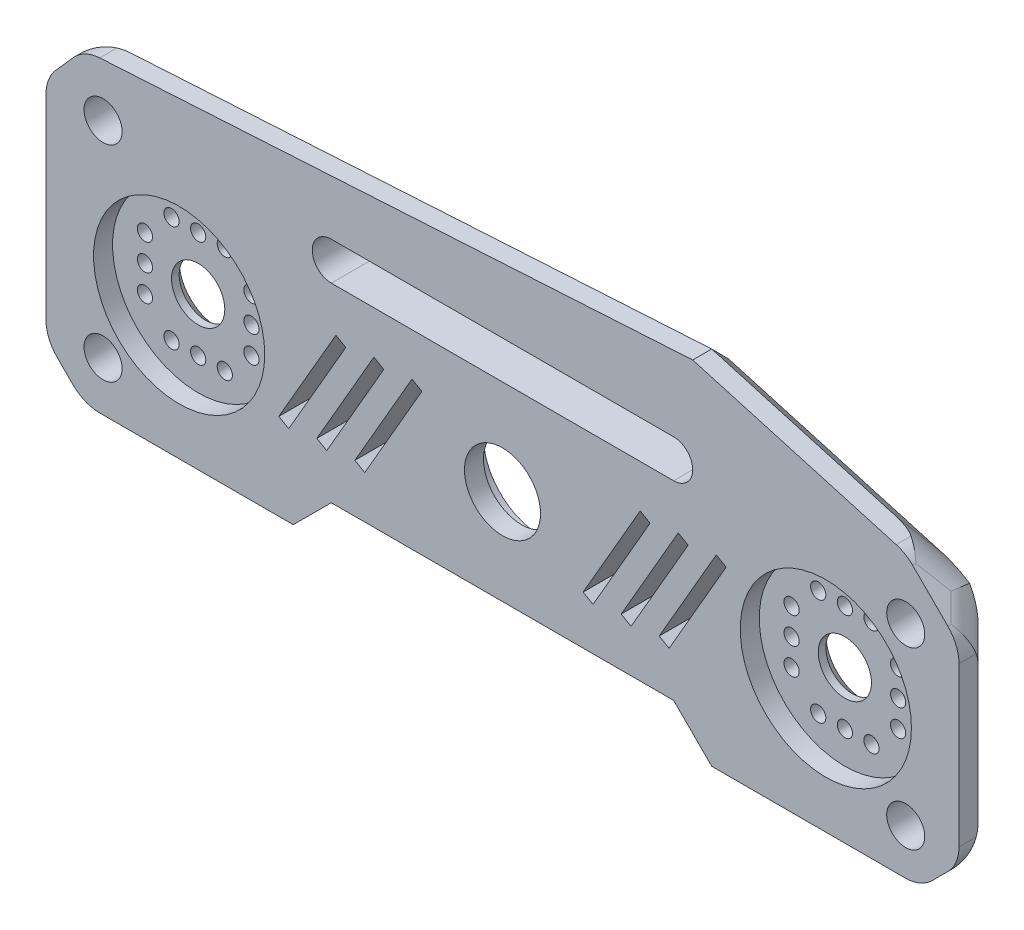
from build123d import *

# Parameters (mm, degrees)
SKETCH1_W           = 17.5
SKETCH1_H           = 25
SKETCH1_W_2         = 50
BOSS_EXTRUDE1_DEPTH = 5
SKETCH2_R           = 11.25
CUT_EXTRUDE1_DEPTH  = 2.5
SKETCH3_R           = 1
SKETCH3_R_2         = 3.5
CUT_EXTRUDE2_DEPTH  = 5
SKETCH4_R           = 5
CUT_EXTRUDE3_DEPTH  = 5
CUT_EXTRUDE4_DEPTH  = 5
CHAMFER3_SIZE       = 1.5
BOSS_EXTRUDE2_DEPTH = 5
CHAMFER4_SIZE       = 2.5
CUT_EXTRUDE11_DEPTH = 5
SKETCH10_R          = 2.5
CUT_EXTRUDE13_DEPTH = 5
CHAMFER5_SIZE       = 5
CHAMFER5_SIZE_2     = 7.280109889
CHAMFER5_SIZE_3     = 5.321683239
FILLET1_R           = 5
SKETCH12_R          = 7.5
CUT_EXTRUDE14_DEPTH = 2.5


# Some blends are built 0.0001 mm under size
with BuildPart() as part:
    # Sketch1 → Boss-Extrude1 (new body)
    with BuildSketch(Plane.XY):
        with Locations((-33.75, 0)):
            Rectangle(SKETCH1_W, SKETCH1_H)
        Polygon((-25, -12.5), (-42.5, -12.5), (-42.5, 12.5), (-25, 12.5), (-25, 17.5), (-60, 17.5), (-60, -17.5), (-25, -17.5), align=None)
        Rectangle(SKETCH1_W_2, SKETCH1_H)
        with Locations((33.75, 0)):
            Rectangle(SKETCH1_W, SKETCH1_H)
        Polygon((42.5, -12.5), (25, -12.5), (25, -17.5), (60, -17.5), (60, 17.5), (25, 17.5), (25, 12.5), (42.5, 12.5), align=None)
    extrude(amount=BOSS_EXTRUDE1_DEPTH)

    # Sketch2 → Cut-Extrude1 (cut)
    with BuildSketch(Plane.XY.offset(5)):
        with Locations((-42.5, 0)):
            Circle(SKETCH2_R)
        with Locations((42.5, 0)):
            Circle(SKETCH2_R)
    extrude(amount=-CUT_EXTRUDE1_DEPTH, mode=Mode.SUBTRACT)

    # Sketch3 → Cut-Extrude2 (cut)
    with BuildSketch(Plane.XY.offset(2.5)):
        with Locations((42.5, 7)):
            Circle(SKETCH3_R)
        with Locations((46, 7)):
            Circle(SKETCH3_R)
        with Locations((39, 7)):
            Circle(SKETCH3_R)
        with Locations((42.5, 0)):
            Circle(SKETCH3_R_2)
        with Locations((-42.5, 0)):
            Circle(SKETCH3_R_2)
        with Locations((-39, 7)):
            Circle(SKETCH3_R)
        with Locations((-46, 7)):
            Circle(SKETCH3_R)
        with Locations((-42.5, 7)):
            Circle(SKETCH3_R)
        with Locations((49.5, 0)):
            Circle(SKETCH3_R)
        with Locations((49.5, -3.5)):
            Circle(SKETCH3_R)
        with Locations((49.5, 3.5)):
            Circle(SKETCH3_R)
        with Locations((42.5, -7)):
            Circle(SKETCH3_R)
        with Locations((39, -7)):
            Circle(SKETCH3_R)
        with Locations((46, -7)):
            Circle(SKETCH3_R)
        with Locations((35.5, 0)):
            Circle(SKETCH3_R)
        with Locations((35.5, 3.5)):
            Circle(SKETCH3_R)
        with Locations((35.5, -3.5)):
            Circle(SKETCH3_R)
        with Locations((-35.5, 3.5)):
            Circle(SKETCH3_R)
        with Locations((-35.5, 0)):
            Circle(SKETCH3_R)
        with Locations((-35.5, -3.5)):
            Circle(SKETCH3_R)
        with Locations((-39, -7)):
            Circle(SKETCH3_R)
        with Locations((-42.5, -7)):
            Circle(SKETCH3_R)
        with Locations((-46, -7)):
            Circle(SKETCH3_R)
        with Locations((-49.5, -3.5)):
            Circle(SKETCH3_R)
        with Locations((-49.5, 0)):
            Circle(SKETCH3_R)
        with Locations((-49.5, 3.5)):
            Circle(SKETCH3_R)
    extrude(amount=-CUT_EXTRUDE2_DEPTH, mode=Mode.SUBTRACT)

    # Sketch4 → Cut-Extrude3 (cut)
    with BuildSketch(Plane.XY.offset(5)):
        Circle(SKETCH4_R)
    extrude(amount=-CUT_EXTRUDE3_DEPTH, mode=Mode.SUBTRACT)

    # Sketch5 → Cut-Extrude4 (cut)
    with BuildSketch(Plane.XY.offset(5)):
        Polygon((20.600480947, -6.120190528), (21.899519053, -6.870190528), (29.399519053, 6.120190528), (28.100480947, 6.870190528), align=None)
        Polygon((15.600480947, -6.120190528), (23.100480947, 6.870190528), (24.399519053, 6.120190528), (16.899519053, -6.870190528), align=None)
        Polygon((10.600480947, -6.120190528), (18.100480947, 6.870190528), (19.399519053, 6.120190528), (11.899519053, -6.870190528), align=None)
        Polygon((-19.399519053, -6.120190528), (-11.899519053, 6.870190528), (-10.600480947, 6.120190528), (-18.100480947, -6.870190528), align=None)
        Polygon((-24.399519053, -6.120190528), (-16.899519053, 6.870190528), (-15.600480947, 6.120190528), (-23.100480947, -6.870190528), align=None)
        Polygon((-29.399519053, -6.120190528), (-21.899519053, 6.870190528), (-20.600480947, 6.120190528), (-28.100480947, -6.870190528), align=None)
    extrude(amount=-CUT_EXTRUDE4_DEPTH, mode=Mode.SUBTRACT)

    # Chamfer3
    chamfer3_edges = [part.edges().sort_by_distance(p)[0] for p in [
        (39, 0, 0),
        (-46, 0, 0),
    ]]
    chamfer(chamfer3_edges, length=CHAMFER3_SIZE)

    # Sketch7 → Boss-Extrude2 (add)
    with BuildSketch(Plane(origin=(0, 0, 0), x_dir=(-1, 0, 0), z_dir=(0, 0, -1))):
        Polygon((-25, 27.5), (-60, 17.5), (-25, 17.5), (-25, 12.5), (25, 12.5), (25, 17.5), (60, 17.5), (60, 22.5), align=None)
    extrude(amount=-BOSS_EXTRUDE2_DEPTH)

    # Chamfer4
    chamfer4_edges = [part.edges().sort_by_distance(p)[0] for p in [
        (-42.5, -17.5, 0),
        (-60, 2.5, 0),
        (60, 0, 0),
        (42.5, -17.5, 0),
        (25, -15, 0),
        (0, -12.5, 0),
        (-25, -15, 0),
        (-25, -17.5, 2.5),
        (25, -17.5, 2.5),
        (25, -12.5, 2.5),
        (-25, -12.5, 2.5),
        (42.5, 22.5, 0),
        (-17.5, 25, 0),
    ]]
    chamfer(chamfer4_edges, length=CHAMFER4_SIZE - 0.0001)  # a hair under: the kernel refuses the full size

    # Sketch8 → Cut-Extrude11 (cut)
    with BuildSketch(Plane.XY.offset(5)):
        with BuildLine():
            Line((-22.5, 17.5), (22.5, 17.5))
            ThreePointArc((22.5, 17.5), (25, 15), (22.5, 12.5))
            Line((22.5, 12.5), (-22.5, 12.5))
            ThreePointArc((-22.5, 12.5), (-25, 15), (-22.5, 17.5))
        make_face()
    extrude(amount=-CUT_EXTRUDE11_DEPTH, mode=Mode.SUBTRACT)

    # Sketch10 → Cut-Extrude13 (cut)
    with BuildSketch(Plane.XY.offset(5)):
        with Locations((-52.5, -11)):
            Circle(SKETCH10_R)
        with Locations((53, -11.5)):
            Circle(SKETCH10_R)
        with Locations(Location((53, 11.5, 0), (0, 0, 180))):
            Circle(SKETCH10_R)
        with Locations(Location((-52.5, 16, 0), (0, 0, 180))):
            Circle(SKETCH10_R)
    extrude(amount=-CUT_EXTRUDE13_DEPTH, mode=Mode.SUBTRACT)

    # Chamfer5
    # the kernel refuses this chamfer: 7.280109889, 5.321683239, 5 mm, written as the material it takes off along each edge
    with BuildSketch(Plane(origin=(-60, -17.5, -10.35851494), x_dir=(0.9996219169112968, -0.027495876610586317, 0), z_dir=(0, 0, 1)), Plane(origin=(60, -17.5, -10.35851494), x_dir=(0.027495876610586317, 0.9996219169112968, 0), z_dir=(0, 0, 1))) as chamfer5_piece_1:
        Polygon((CHAMFER5_SIZE * 0.999621916911, CHAMFER5_SIZE * 0.0274958766106), (-CHAMFER5_SIZE * 0.0274958766106, CHAMFER5_SIZE * 0.999621916911), (0, 0), align=None)
    extrude(amount=28.21692988, mode=Mode.SUBTRACT)
    with BuildSketch(Plane(origin=(60, 17.5, -16.34008853), x_dir=(-0.9561991759280333, 0.2927168187080304, 0), z_dir=(0, 0, 1))) as chamfer5_piece_2:
        Polygon((CHAMFER5_SIZE_2 * 0.999823900998, CHAMFER5_SIZE_2 * 0.0187661149602), (-CHAMFER5_SIZE * 0.292716818708, CHAMFER5_SIZE * 0.956199175928), (0, 0), align=None)
    extrude(amount=40.18007706, mode=Mode.SUBTRACT)
    with BuildSketch(Plane(origin=(-60, 22.5, -11.206616296), x_dir=(-0.02579454785928718, -0.9996672652941752, 0), z_dir=(0, 0, 1))) as chamfer5_piece_3:
        Polygon((CHAMFER5_SIZE_3 * 0.99966726536, CHAMFER5_SIZE_3 * 0.025794547861), (-CHAMFER5_SIZE * 0.0844525191923, CHAMFER5_SIZE * 0.996427504639), (0, 0), align=None)
    extrude(amount=29.913132593, mode=Mode.SUBTRACT)

    # Fillet1
    # the kernel refuses this fillet: 5 mm, written as the material it takes off along each edge
    with BuildSketch(Plane(origin=(-64.166666667, -8.333333333, 6.666566667), x_dir=(0.40824829046408034, 0.8164965809275085, -0.4082482904640807), z_dir=(0.5773502691894717, -0.5773502691899334, -0.5773502691894724)), Plane(origin=(53.333433333, 19.166566667, -4.166666667), x_dir=(-0.4082482904639215, 0.40824829046385264, 0.8164965809277018), z_dir=(0.5773502691896591, -0.5773502691895585, 0.5773502691896599)), Plane(origin=(61.666566667, -10.833433333, -4.166666667), x_dir=(0.40824829046391753, 0.4082482904635908, 0.816496580927835), z_dir=(-0.5773502691899336, -0.5773502691894719, 0.5773502691894719))) as fillet1_piece_1:
        with BuildLine():
            CenterArc((FILLET1_R * 0.577350269189, FILLET1_R), FILLET1_R, 210, 60)
            Line((-FILLET1_R * 0.288675134595, FILLET1_R * 0.5), (0, 0))
            Line((0, 0), (FILLET1_R * 0.577350269189, 0))
        make_face()
    extrude(amount=18.763710544, mode=Mode.SUBTRACT)
    with BuildSketch(Plane(origin=(-50.833333333, -21.666666667, 6.666566667), x_dir=(0.8164965809279436, 0.4082482904636451, -0.4082482904636457), z_dir=(-0.577350269189318, 0.5773502691897797, -0.5773502691897796)), Plane(origin=(64.166666667, -8.333333333, 6.666566667), x_dir=(-0.4082482904636451, 0.8164965809279439, -0.4082482904636454), z_dir=(-0.5773502691897794, -0.5773502691893178, -0.5773502691897802)), Plane(origin=(-51.093826671, 27.197761756, 6.666566667), x_dir=(-0.38357064118824047, -0.4315169713371016, 0.8164965809276222), z_dir=(-0.5424508028963463, -0.6102571532588589, -0.5773502691897726))) as fillet1_piece_2:
        with BuildLine():
            CenterArc((FILLET1_R * 0.57735026919, -FILLET1_R), FILLET1_R, 90, 60)
            Line((-FILLET1_R * 0.288675134595, -FILLET1_R * 0.5), (0, 0))
            Line((0, 0), (FILLET1_R * 0.57735026919, 0))
        make_face()
    extrude(amount=18.763710544, mode=Mode.SUBTRACT)
    with BuildSketch(Plane(origin=(60.502410392, 11.997589608, -2.652776612), x_dir=(-0.7467824303447061, -0.364905051191258, -0.5560218568937372), z_dir=(-0.6360661543203274, 0.6360661543202165, 0.43685202833046355))) as fillet1_piece_3:
        with BuildLine():
            CenterArc((FILLET1_R * 0.485798657646, FILLET1_R), FILLET1_R, 218.179161485, 51.820838515)
            Line((-FILLET1_R * 0.300283099109, FILLET1_R * 0.381877462231), (0, 0))
            Line((0, 0), (FILLET1_R * 0.485798657646, 0))
        make_face()
    extrude(amount=17.867499102, mode=Mode.SUBTRACT)
    with BuildSketch(Plane(origin=(53, 19.5, -0.739175352), x_dir=(0.7071067811866106, -0.7071067811864844, 0), z_dir=(0, 0, 1))) as fillet1_piece_4:
        with BuildLine():
            CenterArc((FILLET1_R * 0.259126028197, -FILLET1_R), FILLET1_R, 90, 29.054604099)
            Line((-FILLET1_R * 0.226516902981, -FILLET1_R * 0.125842723878), (0, 0))
            Line((0, 0), (FILLET1_R * 0.259126028197, 0))
        make_face()
    extrude(amount=8.978250705, mode=Mode.SUBTRACT)
    with BuildSketch(Plane(origin=(60, 12.5, -2.67776953), x_dir=(-0.7071067811866102, 0.707106781186485, 0), z_dir=(0, 0, 1)), Plane(origin=(55, -17.5, -2.67776953), x_dir=(0.7071067811868306, 0.7071067811862645, 0), z_dir=(0, 0, 1)), Plane(origin=(-60, -12.5, -2.67776953), x_dir=(0.7071067811862649, -0.7071067811868301, 0), z_dir=(0, 0, 1)), Plane(origin=(-55.008628134, 22.79361011, -2.67776953), x_dir=(-0.6643638388296346, -0.7474093186839131, 0), z_dir=(0, 0, 1))) as fillet1_piece_5:
        with BuildLine():
            CenterArc((FILLET1_R * 0.414213562373, FILLET1_R), FILLET1_R, 225, 45)
            Line((-FILLET1_R * 0.292893218813, FILLET1_R * 0.292893218814), (0, 0))
            Line((0, 0), (FILLET1_R * 0.414213562373, 0))
        make_face()
    extrude(amount=12.855439059, mode=Mode.SUBTRACT)
    with BuildSketch(Plane(origin=(60, -12.5, -2.67776953), x_dir=(-0.7071067811868297, -0.7071067811862654, 0), z_dir=(0, 0, 1)), Plane(origin=(-55, -17.5, -2.67776953), x_dir=(-0.7071067811862645, 0.7071067811868306, 0), z_dir=(0, 0, 1))) as fillet1_piece_6:
        with BuildLine():
            CenterArc((FILLET1_R * 0.414213562373, -FILLET1_R), FILLET1_R, 90, 45)
            Line((-FILLET1_R * 0.292893218814, -FILLET1_R * 0.292893218814), (0, 0))
            Line((0, 0), (FILLET1_R * 0.414213562373, 0))
        make_face()
    extrude(amount=12.855439059, mode=Mode.SUBTRACT)
    with BuildSketch(Plane(origin=(-60, 17.178316761, -2.252591529), x_dir=(0.6643638388296347, 0.7474093186839131, 0), z_dir=(0, 0, 1))) as fillet1_piece_7:
        with BuildLine():
            CenterArc((FILLET1_R * 0.380199322349, -FILLET1_R), FILLET1_R, 90, 41.633539337)
            Line((-FILLET1_R * 0.284164516481, -FILLET1_R * 0.252590681316), (0, 0))
            Line((0, 0), (FILLET1_R * 0.380199322349, 0))
        make_face()
    extrude(amount=12.005083059, mode=Mode.SUBTRACT)
    with BuildSketch(Plane(origin=(-53.658288342, 24.312742376, -3.841811658), x_dir=(0.440204389240274, -0.7825855808709965, -0.44020438924027366), z_dir=(-0.5533715710926945, -0.6225430174797603, 0.5533715710926953))) as fillet1_piece_8:
        with BuildLine():
            CenterArc((FILLET1_R * 0.555404268528, FILLET1_R), FILLET1_R, 211.904040139, 58.095959861)
            Line((-FILLET1_R * 0.293530154836, FILLET1_R * 0.471501802437), (0, 0))
            Line((0, 0), (FILLET1_R * 0.555404268528, 0))
        make_face()
    extrude(amount=18.402686095, mode=Mode.SUBTRACT)

    # Sketch12 → Cut-Extrude14 (cut)
    with BuildSketch(Plane(origin=(0, 0, 0), x_dir=(-1, 0, 0), z_dir=(0, 0, -1))):
        Circle(SKETCH12_R)
    extrude(amount=-CUT_EXTRUDE14_DEPTH, mode=Mode.SUBTRACT)


solid = part.part
